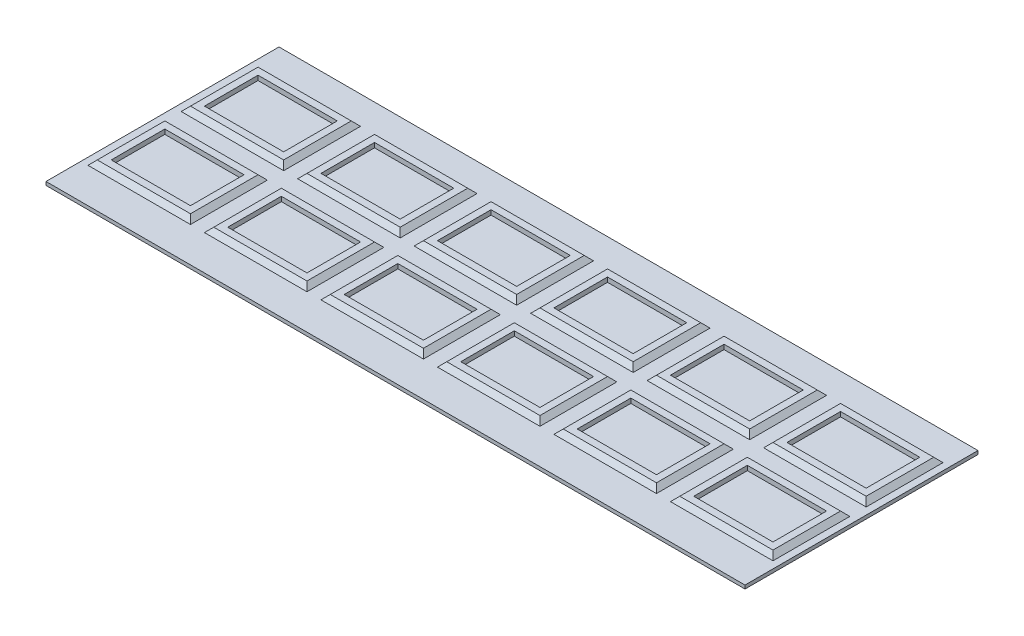
from build123d import *

# Parameters (mm, degrees)
SKETCH1_W                  = 3000
SKETCH1_H                  = 1000
BOSS_EXTRUDE1_DEPTH        = 15
SKETCH2_W                  = 400
SKETCH2_H                  = 290
SKETCH2_W_2                = 340
SKETCH2_H_2                = 230
BOSS_EXTRUDE2_DEPTH        = 20
CHAMFER1_SIZE              = 20
LPATTERN1_COUNT            = 6
LPATTERN1_PITCH            = 500
LPATTERN1_COUNT_DIR2       = 2
LPATTERN1_PITCH_DIR2       = 400
CHAMFER1_OF_LPATTERN1_SIZE = 20


with BuildPart() as part:
    # Sketch1 → Boss-Extrude1 (new body)
    with BuildSketch(Plane(origin=(0, 0, 0), x_dir=(1, 0, 0), z_dir=(0, 1, 0))):
        Rectangle(SKETCH1_W, SKETCH1_H)
    extrude(amount=BOSS_EXTRUDE1_DEPTH)

    # Sketch2 → Boss-Extrude2 (add)
    with BuildSketch(Plane(origin=(0, 15, 0), x_dir=(1, 0, 0), z_dir=(0, 1, 0))):
        with Locations((-1250, -185)):
            Rectangle(SKETCH2_W, SKETCH2_H)
        with Locations((-1250, -185)):
            Rectangle(SKETCH2_W_2, SKETCH2_H_2, mode=Mode.SUBTRACT)
    boss_extrude2 = extrude(amount=BOSS_EXTRUDE2_DEPTH)

    # Chamfer1
    chamfer1_edges = [part.edges().sort_by_distance(p)[0] for p in [
        (-1450, 15, 185),
        (-1050, 15, 185),
        (-1250, 15, 330),
        (-1250, 15, 40),
    ]]
    chamfer(chamfer1_edges, length=CHAMFER1_SIZE - 0.0001)  # a hair under: the kernel refuses the full size

    # LPattern1: Boss-Extrude2 6 × 2
    with Locations(*[(i * LPATTERN1_PITCH, 0, -j * LPATTERN1_PITCH_DIR2) for i in range(LPATTERN1_COUNT) for j in range(LPATTERN1_COUNT_DIR2) if (i, j) != (0, 0)]):
        add(boss_extrude2)

    # Chamfer1 of LPattern1
    chamfer1_of_lpattern1_edges = [part.edges().sort_by_distance(p)[0] for p in [
        (-1450, 15, -215),
        (-1050, 15, -215),
        (-1250, 15, -70),
        (-1250, 15, -360),
        (-950, 15, 185),
        (-550, 15, 185),
        (-750, 15, 330),
        (-750, 15, 40),
        (-950, 15, -215),
        (-550, 15, -215),
        (-750, 15, -70),
        (-750, 15, -360),
        (-450, 15, 185),
        (-50, 15, 185),
        (-250, 15, 330),
        (-250, 15, 40),
        (-450, 15, -215),
        (-50, 15, -215),
        (-250, 15, -70),
        (-250, 15, -360),
        (50, 15, 185),
        (450, 15, 185),
        (250, 15, 330),
        (250, 15, 40),
        (50, 15, -215),
        (450, 15, -215),
        (250, 15, -70),
        (250, 15, -360),
        (550, 15, 185),
        (950, 15, 185),
        (750, 15, 330),
        (750, 15, 40),
        (550, 15, -215),
        (950, 15, -215),
        (750, 15, -70),
        (750, 15, -360),
        (1050, 15, 185),
        (1450, 15, 185),
        (1250, 15, 330),
        (1250, 15, 40),
        (1050, 15, -215),
        (1450, 15, -215),
        (1250, 15, -70),
        (1250, 15, -360),
    ]]
    chamfer(chamfer1_of_lpattern1_edges, length=CHAMFER1_OF_LPATTERN1_SIZE - 0.0001)  # a hair under: the kernel refuses the full size


solid = part.part
